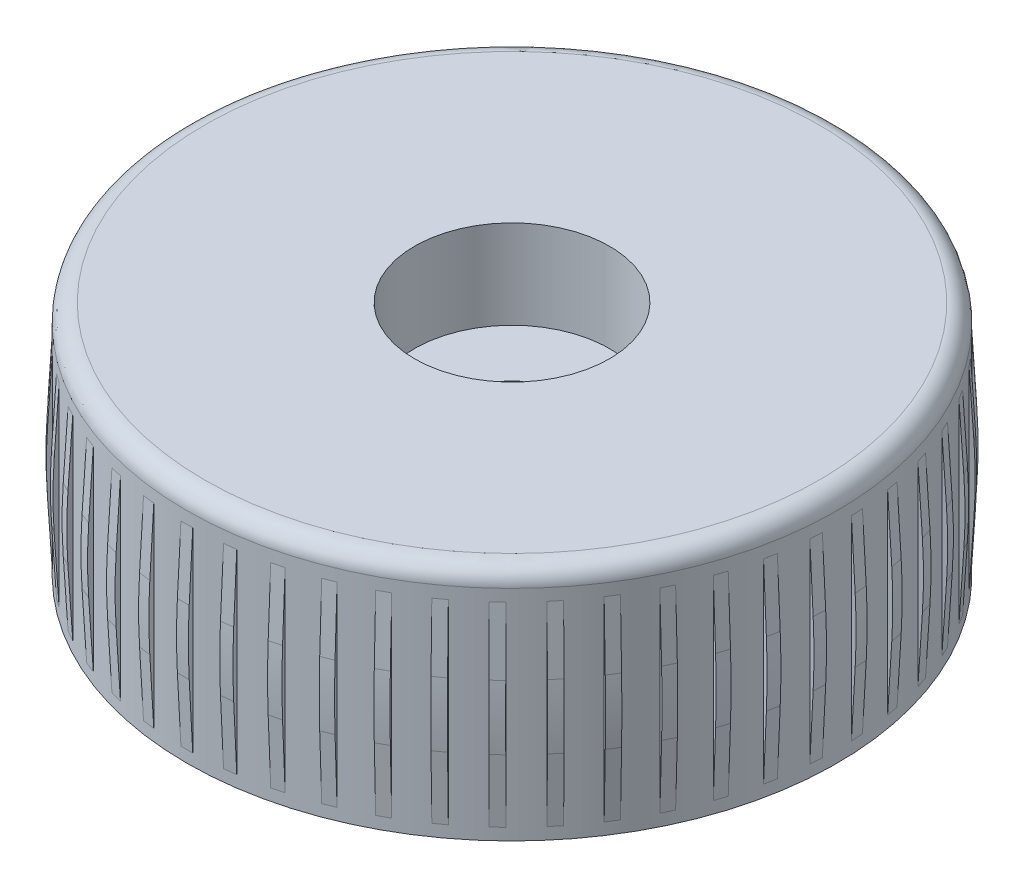
from build123d import *

# Parameters (mm, degrees)
SKETCH1_R                = 27.5
SKETCH1_R_2              = 2.5
BOSS_EXTRUDE1_DEPTH      = 20
CUT_EXTRUDE3_START       = -15
SKETCH5_R                = 22.225
CUT_EXTRUDE3_DEPTH       = 29.732139211
FILLET1_R                = 1.5
BOSS_EXTRUDE2_DEPTH      = 0.5
BOSS_EXTRUDE2_DEPTH_BACK = 0.5
FILLET2_R                = 50
CIRPATTERN3_COUNT        = 50
SKETCH6_R                = 8.25
CUT_EXTRUDE4_DEPTH       = 7.5


with BuildPart() as part:
    # Sketch1 → Boss-Extrude1 (new body)
    with BuildSketch(Plane(origin=(0, 0, 0), x_dir=(1, 0, 0), z_dir=(0, 1, 0))):
        Circle(SKETCH1_R)
        Circle(SKETCH1_R_2, mode=Mode.SUBTRACT)
    extrude(amount=BOSS_EXTRUDE1_DEPTH)

    # Sketch5 → Cut-Extrude3 (cut, through all)
    with BuildSketch(Plane(origin=(0, 20, 0), x_dir=(1, 0, 0), z_dir=(0, 1, 0)).offset(CUT_EXTRUDE3_START)):
        Circle(SKETCH5_R)
    extrude(amount=-CUT_EXTRUDE3_DEPTH, mode=Mode.SUBTRACT)

    # Fillet1
    fillet1_edges = [part.edges().sort_by_distance(p)[0] for p in [
        (-27.5, 20, 0),
    ]]
    fillet(fillet1_edges, radius=FILLET1_R)

    # Sketch6 → Cut-Extrude4 (cut)
    with BuildSketch(Plane(origin=(0, 20, 0), x_dir=(1, 0, 0), z_dir=(0, 1, 0))):
        Circle(SKETCH6_R)
    extrude(amount=-CUT_EXTRUDE4_DEPTH, mode=Mode.SUBTRACT)


with BuildPart() as body_2:
    # Sketch2 → Boss-Extrude2 (new, two sides: drawn at the far end of the back side and taken through both)
    with BuildSketch(Plane(origin=(0, 0, 0), x_dir=(0, 0, -1), z_dir=(1, 0, 0)).offset(-BOSS_EXTRUDE2_DEPTH_BACK)):
        Polygon((27.5, 17.5), (27.95, 9.25), (27.5, 1), align=None)
    extrude(amount=BOSS_EXTRUDE2_DEPTH + BOSS_EXTRUDE2_DEPTH_BACK)

    # Fillet2
    fillet2_edges = [body_2.edges().sort_by_distance(p)[0] for p in [
        (0, 9.25, -27.95),
    ]]
    fillet(fillet2_edges, radius=FILLET2_R)


with BuildPart() as cirpattern3_1:
    # CirPattern3: pattern copy
    add(body_2.part.rotate(Axis((0, 18.5, 0), (0, -1, 0)), 1 * 360 / CIRPATTERN3_COUNT))


with BuildPart() as cirpattern3_2:
    # CirPattern3: pattern copy
    add(body_2.part.rotate(Axis((0, 18.5, 0), (0, -1, 0)), 2 * 360 / CIRPATTERN3_COUNT))


with BuildPart() as cirpattern3_3:
    # CirPattern3: pattern copy
    add(body_2.part.rotate(Axis((0, 18.5, 0), (0, -1, 0)), 3 * 360 / CIRPATTERN3_COUNT))


with BuildPart() as cirpattern3_4:
    # CirPattern3: pattern copy
    add(body_2.part.rotate(Axis((0, 18.5, 0), (0, -1, 0)), 4 * 360 / CIRPATTERN3_COUNT))


with BuildPart() as cirpattern3_5:
    # CirPattern3: pattern copy
    add(body_2.part.rotate(Axis((0, 18.5, 0), (0, -1, 0)), 5 * 360 / CIRPATTERN3_COUNT))


with BuildPart() as cirpattern3_6:
    # CirPattern3: pattern copy
    add(body_2.part.rotate(Axis((0, 18.5, 0), (0, -1, 0)), 6 * 360 / CIRPATTERN3_COUNT))


with BuildPart() as cirpattern3_7:
    # CirPattern3: pattern copy
    add(body_2.part.rotate(Axis((0, 18.5, 0), (0, -1, 0)), 7 * 360 / CIRPATTERN3_COUNT))


with BuildPart() as cirpattern3_8:
    # CirPattern3: pattern copy
    add(body_2.part.rotate(Axis((0, 18.5, 0), (0, -1, 0)), 8 * 360 / CIRPATTERN3_COUNT))


with BuildPart() as cirpattern3_9:
    # CirPattern3: pattern copy
    add(body_2.part.rotate(Axis((0, 18.5, 0), (0, -1, 0)), 9 * 360 / CIRPATTERN3_COUNT))


with BuildPart() as cirpattern3_10:
    # CirPattern3: pattern copy
    add(body_2.part.rotate(Axis((0, 18.5, 0), (0, -1, 0)), 10 * 360 / CIRPATTERN3_COUNT))


with BuildPart() as cirpattern3_11:
    # CirPattern3: pattern copy
    add(body_2.part.rotate(Axis((0, 18.5, 0), (0, -1, 0)), 11 * 360 / CIRPATTERN3_COUNT))


with BuildPart() as cirpattern3_12:
    # CirPattern3: pattern copy
    add(body_2.part.rotate(Axis((0, 18.5, 0), (0, -1, 0)), 12 * 360 / CIRPATTERN3_COUNT))


with BuildPart() as cirpattern3_13:
    # CirPattern3: pattern copy
    add(body_2.part.rotate(Axis((0, 18.5, 0), (0, -1, 0)), 13 * 360 / CIRPATTERN3_COUNT))


with BuildPart() as cirpattern3_14:
    # CirPattern3: pattern copy
    add(body_2.part.rotate(Axis((0, 18.5, 0), (0, -1, 0)), 14 * 360 / CIRPATTERN3_COUNT))


with BuildPart() as cirpattern3_15:
    # CirPattern3: pattern copy
    add(body_2.part.rotate(Axis((0, 18.5, 0), (0, -1, 0)), 15 * 360 / CIRPATTERN3_COUNT))


with BuildPart() as cirpattern3_16:
    # CirPattern3: pattern copy
    add(body_2.part.rotate(Axis((0, 18.5, 0), (0, -1, 0)), 16 * 360 / CIRPATTERN3_COUNT))


with BuildPart() as cirpattern3_17:
    # CirPattern3: pattern copy
    add(body_2.part.rotate(Axis((0, 18.5, 0), (0, -1, 0)), 17 * 360 / CIRPATTERN3_COUNT))


with BuildPart() as cirpattern3_18:
    # CirPattern3: pattern copy
    add(body_2.part.rotate(Axis((0, 18.5, 0), (0, -1, 0)), 18 * 360 / CIRPATTERN3_COUNT))


with BuildPart() as cirpattern3_19:
    # CirPattern3: pattern copy
    add(body_2.part.rotate(Axis((0, 18.5, 0), (0, -1, 0)), 19 * 360 / CIRPATTERN3_COUNT))


with BuildPart() as cirpattern3_20:
    # CirPattern3: pattern copy
    add(body_2.part.rotate(Axis((0, 18.5, 0), (0, -1, 0)), 20 * 360 / CIRPATTERN3_COUNT))


with BuildPart() as cirpattern3_21:
    # CirPattern3: pattern copy
    add(body_2.part.rotate(Axis((0, 18.5, 0), (0, -1, 0)), 21 * 360 / CIRPATTERN3_COUNT))


with BuildPart() as cirpattern3_22:
    # CirPattern3: pattern copy
    add(body_2.part.rotate(Axis((0, 18.5, 0), (0, -1, 0)), 22 * 360 / CIRPATTERN3_COUNT))


with BuildPart() as cirpattern3_23:
    # CirPattern3: pattern copy
    add(body_2.part.rotate(Axis((0, 18.5, 0), (0, -1, 0)), 23 * 360 / CIRPATTERN3_COUNT))


with BuildPart() as cirpattern3_24:
    # CirPattern3: pattern copy
    add(body_2.part.rotate(Axis((0, 18.5, 0), (0, -1, 0)), 24 * 360 / CIRPATTERN3_COUNT))


with BuildPart() as cirpattern3_25:
    # CirPattern3: pattern copy
    add(body_2.part.rotate(Axis((0, 18.5, 0), (0, -1, 0)), 25 * 360 / CIRPATTERN3_COUNT))


with BuildPart() as cirpattern3_26:
    # CirPattern3: pattern copy
    add(body_2.part.rotate(Axis((0, 18.5, 0), (0, -1, 0)), 26 * 360 / CIRPATTERN3_COUNT))


with BuildPart() as cirpattern3_27:
    # CirPattern3: pattern copy
    add(body_2.part.rotate(Axis((0, 18.5, 0), (0, -1, 0)), 27 * 360 / CIRPATTERN3_COUNT))


with BuildPart() as cirpattern3_28:
    # CirPattern3: pattern copy
    add(body_2.part.rotate(Axis((0, 18.5, 0), (0, -1, 0)), 28 * 360 / CIRPATTERN3_COUNT))


with BuildPart() as cirpattern3_29:
    # CirPattern3: pattern copy
    add(body_2.part.rotate(Axis((0, 18.5, 0), (0, -1, 0)), 29 * 360 / CIRPATTERN3_COUNT))


with BuildPart() as cirpattern3_30:
    # CirPattern3: pattern copy
    add(body_2.part.rotate(Axis((0, 18.5, 0), (0, -1, 0)), 30 * 360 / CIRPATTERN3_COUNT))


with BuildPart() as cirpattern3_31:
    # CirPattern3: pattern copy
    add(body_2.part.rotate(Axis((0, 18.5, 0), (0, -1, 0)), 31 * 360 / CIRPATTERN3_COUNT))


with BuildPart() as cirpattern3_32:
    # CirPattern3: pattern copy
    add(body_2.part.rotate(Axis((0, 18.5, 0), (0, -1, 0)), 32 * 360 / CIRPATTERN3_COUNT))


with BuildPart() as cirpattern3_33:
    # CirPattern3: pattern copy
    add(body_2.part.rotate(Axis((0, 18.5, 0), (0, -1, 0)), 33 * 360 / CIRPATTERN3_COUNT))


with BuildPart() as cirpattern3_34:
    # CirPattern3: pattern copy
    add(body_2.part.rotate(Axis((0, 18.5, 0), (0, -1, 0)), 34 * 360 / CIRPATTERN3_COUNT))


with BuildPart() as cirpattern3_35:
    # CirPattern3: pattern copy
    add(body_2.part.rotate(Axis((0, 18.5, 0), (0, -1, 0)), 35 * 360 / CIRPATTERN3_COUNT))


with BuildPart() as cirpattern3_36:
    # CirPattern3: pattern copy
    add(body_2.part.rotate(Axis((0, 18.5, 0), (0, -1, 0)), 36 * 360 / CIRPATTERN3_COUNT))


with BuildPart() as cirpattern3_37:
    # CirPattern3: pattern copy
    add(body_2.part.rotate(Axis((0, 18.5, 0), (0, -1, 0)), 37 * 360 / CIRPATTERN3_COUNT))


with BuildPart() as cirpattern3_38:
    # CirPattern3: pattern copy
    add(body_2.part.rotate(Axis((0, 18.5, 0), (0, -1, 0)), 38 * 360 / CIRPATTERN3_COUNT))


with BuildPart() as cirpattern3_39:
    # CirPattern3: pattern copy
    add(body_2.part.rotate(Axis((0, 18.5, 0), (0, -1, 0)), 39 * 360 / CIRPATTERN3_COUNT))


with BuildPart() as cirpattern3_40:
    # CirPattern3: pattern copy
    add(body_2.part.rotate(Axis((0, 18.5, 0), (0, -1, 0)), 40 * 360 / CIRPATTERN3_COUNT))


with BuildPart() as cirpattern3_41:
    # CirPattern3: pattern copy
    add(body_2.part.rotate(Axis((0, 18.5, 0), (0, -1, 0)), 41 * 360 / CIRPATTERN3_COUNT))


with BuildPart() as cirpattern3_42:
    # CirPattern3: pattern copy
    add(body_2.part.rotate(Axis((0, 18.5, 0), (0, -1, 0)), 42 * 360 / CIRPATTERN3_COUNT))


with BuildPart() as cirpattern3_43:
    # CirPattern3: pattern copy
    add(body_2.part.rotate(Axis((0, 18.5, 0), (0, -1, 0)), 43 * 360 / CIRPATTERN3_COUNT))


with BuildPart() as cirpattern3_44:
    # CirPattern3: pattern copy
    add(body_2.part.rotate(Axis((0, 18.5, 0), (0, -1, 0)), 44 * 360 / CIRPATTERN3_COUNT))


with BuildPart() as cirpattern3_45:
    # CirPattern3: pattern copy
    add(body_2.part.rotate(Axis((0, 18.5, 0), (0, -1, 0)), 45 * 360 / CIRPATTERN3_COUNT))


with BuildPart() as cirpattern3_46:
    # CirPattern3: pattern copy
    add(body_2.part.rotate(Axis((0, 18.5, 0), (0, -1, 0)), 46 * 360 / CIRPATTERN3_COUNT))


with BuildPart() as cirpattern3_47:
    # CirPattern3: pattern copy
    add(body_2.part.rotate(Axis((0, 18.5, 0), (0, -1, 0)), 47 * 360 / CIRPATTERN3_COUNT))


with BuildPart() as cirpattern3_48:
    # CirPattern3: pattern copy
    add(body_2.part.rotate(Axis((0, 18.5, 0), (0, -1, 0)), 48 * 360 / CIRPATTERN3_COUNT))


with BuildPart() as cirpattern3_49:
    # CirPattern3: pattern copy
    add(body_2.part.rotate(Axis((0, 18.5, 0), (0, -1, 0)), 49 * 360 / CIRPATTERN3_COUNT))


solid = Compound([part.part, body_2.part, cirpattern3_1.part, cirpattern3_2.part, cirpattern3_3.part, cirpattern3_4.part, cirpattern3_5.part, cirpattern3_6.part, cirpattern3_7.part, cirpattern3_8.part, cirpattern3_9.part, cirpattern3_10.part, cirpattern3_11.part, cirpattern3_12.part, cirpattern3_13.part, cirpattern3_14.part, cirpattern3_15.part, cirpattern3_16.part, cirpattern3_17.part, cirpattern3_18.part, cirpattern3_19.part, cirpattern3_20.part, cirpattern3_21.part, cirpattern3_22.part, cirpattern3_23.part, cirpattern3_24.part, cirpattern3_25.part, cirpattern3_26.part, cirpattern3_27.part, cirpattern3_28.part, cirpattern3_29.part, cirpattern3_30.part, cirpattern3_31.part, cirpattern3_32.part, cirpattern3_33.part, cirpattern3_34.part, cirpattern3_35.part, cirpattern3_36.part, cirpattern3_37.part, cirpattern3_38.part, cirpattern3_39.part, cirpattern3_40.part, cirpattern3_41.part, cirpattern3_42.part, cirpattern3_43.part, cirpattern3_44.part, cirpattern3_45.part, cirpattern3_46.part, cirpattern3_47.part, cirpattern3_48.part, cirpattern3_49.part])
